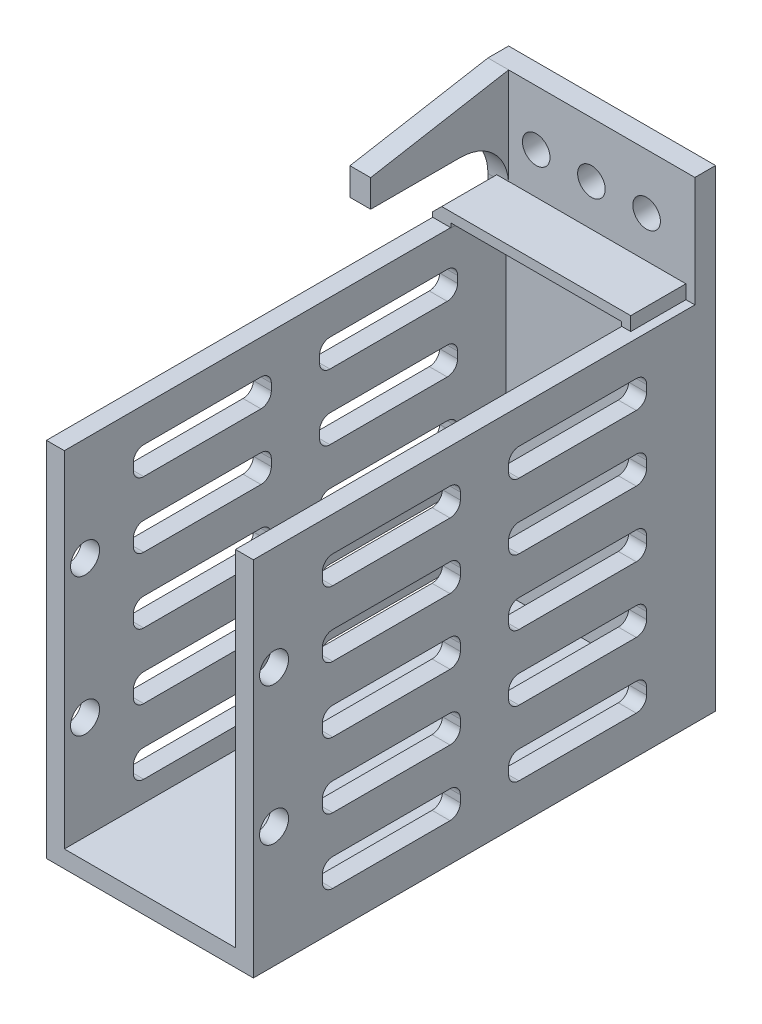
from build123d import *

# Parameters (mm, degrees)
BOSS_EXTRUDE1_DEPTH = 3
SKETCH2_W           = 2.6
SKETCH2_H           = 50
BOSS_EXTRUDE2_DEPTH = 64
SKETCH3_R           = 2
CUT_EXTRUDE1_DEPTH  = 143.577208896
SKETCH4_W           = 30
SKETCH4_H           = 67
BOSS_EXTRUDE3_DEPTH = 2.5
CUT_EXTRUDE2_DEPTH  = 131.265360039
SKETCH7_R           = 2.1
CUT_EXTRUDE3_DEPTH  = 131.265360039
BOSS_EXTRUDE4_DEPTH = 8
SKETCH9_W           = 3
SKETCH9_H           = 3.5
BOSS_EXTRUDE5_DEPTH = 20
CHAMFER1_SIZE       = 4
CHAMFER1_SIZE_2     = 22.685127278
FILLET1_R           = 7
CHAMFER2_SIZE       = 2


with BuildPart() as part:
    # Sketch1 → Boss-Extrude1 (new body)
    with BuildSketch(Plane.XY):
        Polygon((-72, -55.110705908), (-72, -105.110705908), (-42, -105.110705908), (-42, -55.110705908), (-42, -39.110705908), (-72, -39.110705908), align=None)
    extrude(amount=BOSS_EXTRUDE1_DEPTH)

    # Sketch2 → Boss-Extrude2 (add)
    with BuildSketch(Plane.XY.offset(3)):
        with Locations((-70.7, -80.110705908)):
            Rectangle(SKETCH2_W, SKETCH2_H)
        with Locations((-43.3, -80.110705908)):
            Rectangle(SKETCH2_W, SKETCH2_H)
    extrude(amount=BOSS_EXTRUDE2_DEPTH)

    # Sketch3 → Cut-Extrude1 (cut, through all)
    with BuildSketch(Plane.XY.offset(3)):
        with Locations((-65, -47.110705908)):
            Circle(SKETCH3_R)
        with Locations((-57, -47.110705908)):
            Circle(SKETCH3_R)
        with Locations((-49, -47.110705908)):
            Circle(SKETCH3_R)
    extrude(amount=-CUT_EXTRUDE1_DEPTH, mode=Mode.SUBTRACT)

    # Sketch4 → Boss-Extrude3 (add)
    with BuildSketch(Plane.XZ.offset(105.110705908)):
        with Locations((-57, 33.5)):
            Rectangle(SKETCH4_W, SKETCH4_H)
    extrude(amount=BOSS_EXTRUDE3_DEPTH)

    # Sketch5 → Cut-Extrude2 (cut, through all)
    with BuildSketch(Plane.ZY.offset(72)):
        with BuildLine():
            Line((55.5, -60.110705908), (38.5, -60.110705908))
            ThreePointArc((38.5, -60.110705908), (37.439339828, -60.550045736), (37, -61.610705908))
            Line((37, -61.610705908), (37, -62.610705908))
            ThreePointArc((37, -62.610705908), (37.439339828, -63.67136608), (38.5, -64.110705908))
            Line((38.5, -64.110705908), (55.5, -64.110705908))
            ThreePointArc((55.5, -64.110705908), (56.560660172, -63.67136608), (57, -62.610705908))
            Line((57, -62.610705908), (57, -61.610705908))
            ThreePointArc((57, -61.610705908), (56.560660172, -60.550045736), (55.5, -60.110705908))
        make_face()
        with BuildLine():
            Line((57, -71.110705908), (57, -72.110705908))
            ThreePointArc((57, -72.110705908), (56.560660172, -73.17136608), (55.5, -73.610705908))
            Line((55.5, -73.610705908), (38.5, -73.610705908))
            ThreePointArc((38.5, -73.610705908), (37.439339828, -73.17136608), (37, -72.110705908))
            Line((37, -72.110705908), (37, -71.110705908))
            ThreePointArc((37, -71.110705908), (37.439339828, -70.050045736), (38.5, -69.610705908))
            Line((38.5, -69.610705908), (55.5, -69.610705908))
            ThreePointArc((55.5, -69.610705908), (56.560660172, -70.050045736), (57, -71.110705908))
        make_face()
        with BuildLine():
            Line((57, -80.610705908), (57, -81.610705908))
            ThreePointArc((57, -81.610705908), (56.560660172, -82.67136608), (55.5, -83.110705908))
            Line((55.5, -83.110705908), (38.5, -83.110705908))
            ThreePointArc((38.5, -83.110705908), (37.439339828, -82.67136608), (37, -81.610705908))
            Line((37, -81.610705908), (37, -80.610705908))
            ThreePointArc((37, -80.610705908), (37.439339828, -79.550045736), (38.5, -79.110705908))
            Line((38.5, -79.110705908), (55.5, -79.110705908))
            ThreePointArc((55.5, -79.110705908), (56.560660172, -79.550045736), (57, -80.610705908))
        make_face()
        with BuildLine():
            Line((57, -90.110705908), (57, -91.110705908))
            ThreePointArc((57, -91.110705908), (56.560660172, -92.17136608), (55.5, -92.610705908))
            Line((55.5, -92.610705908), (38.5, -92.610705908))
            ThreePointArc((38.5, -92.610705908), (37.439339828, -92.17136608), (37, -91.110705908))
            Line((37, -91.110705908), (37, -90.110705908))
            ThreePointArc((37, -90.110705908), (37.439339828, -89.050045736), (38.5, -88.610705908))
            Line((38.5, -88.610705908), (55.5, -88.610705908))
            ThreePointArc((55.5, -88.610705908), (56.560660172, -89.050045736), (57, -90.110705908))
        make_face()
        with BuildLine():
            Line((57, -99.610705908), (57, -100.610705908))
            ThreePointArc((57, -100.610705908), (56.560660172, -101.67136608), (55.5, -102.110705908))
            Line((55.5, -102.110705908), (38.5, -102.110705908))
            ThreePointArc((38.5, -102.110705908), (37.439339828, -101.67136608), (37, -100.610705908))
            Line((37, -100.610705908), (37, -99.610705908))
            ThreePointArc((37, -99.610705908), (37.439339828, -98.550045736), (38.5, -98.110705908))
            Line((38.5, -98.110705908), (55.5, -98.110705908))
            ThreePointArc((55.5, -98.110705908), (56.560660172, -98.550045736), (57, -99.610705908))
        make_face()
        with BuildLine():
            Line((11.5, -102.110705908), (28.5, -102.110705908))
            ThreePointArc((28.5, -102.110705908), (29.560660172, -101.67136608), (30, -100.610705908))
            Line((30, -100.610705908), (30, -99.610705908))
            ThreePointArc((30, -99.610705908), (29.560660172, -98.550045736), (28.5, -98.110705908))
            Line((28.5, -98.110705908), (11.5, -98.110705908))
            ThreePointArc((11.5, -98.110705908), (10.439339828, -98.550045736), (10, -99.610705908))
            Line((10, -99.610705908), (10, -100.610705908))
            ThreePointArc((10, -100.610705908), (10.439339828, -101.67136608), (11.5, -102.110705908))
        make_face()
        with BuildLine():
            Line((11.5, -92.610705908), (28.5, -92.610705908))
            ThreePointArc((28.5, -92.610705908), (29.560660172, -92.17136608), (30, -91.110705908))
            Line((30, -91.110705908), (30, -90.110705908))
            ThreePointArc((30, -90.110705908), (29.560660172, -89.050045736), (28.5, -88.610705908))
            Line((28.5, -88.610705908), (11.5, -88.610705908))
            ThreePointArc((11.5, -88.610705908), (10.439339828, -89.050045736), (10, -90.110705908))
            Line((10, -90.110705908), (10, -91.110705908))
            ThreePointArc((10, -91.110705908), (10.439339828, -92.17136608), (11.5, -92.610705908))
        make_face()
        with BuildLine():
            Line((11.5, -83.110705908), (28.5, -83.110705908))
            ThreePointArc((28.5, -83.110705908), (29.560660172, -82.67136608), (30, -81.610705908))
            Line((30, -81.610705908), (30, -80.610705908))
            ThreePointArc((30, -80.610705908), (29.560660172, -79.550045736), (28.5, -79.110705908))
            Line((28.5, -79.110705908), (11.5, -79.110705908))
            ThreePointArc((11.5, -79.110705908), (10.439339828, -79.550045736), (10, -80.610705908))
            Line((10, -80.610705908), (10, -81.610705908))
            ThreePointArc((10, -81.610705908), (10.439339828, -82.67136608), (11.5, -83.110705908))
        make_face()
        with BuildLine():
            Line((11.5, -73.610705908), (28.5, -73.610705908))
            ThreePointArc((28.5, -73.610705908), (29.560660172, -73.17136608), (30, -72.110705908))
            Line((30, -72.110705908), (30, -71.110705908))
            ThreePointArc((30, -71.110705908), (29.560660172, -70.050045736), (28.5, -69.610705908))
            Line((28.5, -69.610705908), (11.5, -69.610705908))
            ThreePointArc((11.5, -69.610705908), (10.439339828, -70.050045736), (10, -71.110705908))
            Line((10, -71.110705908), (10, -72.110705908))
            ThreePointArc((10, -72.110705908), (10.439339828, -73.17136608), (11.5, -73.610705908))
        make_face()
        with BuildLine():
            Line((30, -61.610705908), (30, -62.610705908))
            ThreePointArc((30, -62.610705908), (29.560660172, -63.67136608), (28.5, -64.110705908))
            Line((28.5, -64.110705908), (11.5, -64.110705908))
            ThreePointArc((11.5, -64.110705908), (10.439339828, -63.67136608), (10, -62.610705908))
            Line((10, -62.610705908), (10, -61.610705908))
            ThreePointArc((10, -61.610705908), (10.439339828, -60.550045736), (11.5, -60.110705908))
            Line((11.5, -60.110705908), (28.5, -60.110705908))
            ThreePointArc((28.5, -60.110705908), (29.560660172, -60.550045736), (30, -61.610705908))
        make_face()
    extrude(amount=-CUT_EXTRUDE2_DEPTH, mode=Mode.SUBTRACT)

    # Sketch7 → Cut-Extrude3 (cut, through all)
    with BuildSketch(Plane.ZY.offset(72)):
        with Locations((64, -70.110705908)):
            Circle(SKETCH7_R)
        with Locations((64, -90.110705908)):
            Circle(SKETCH7_R)
    extrude(amount=-CUT_EXTRUDE3_DEPTH, mode=Mode.SUBTRACT)

    # Sketch8 → Boss-Extrude4 (add)
    with BuildSketch(Plane.XY.offset(3)):
        Polygon((-69.338828218, -54.510705908), (-44.661171782, -54.510705908), (-44.661171782, -55.110705908), (-43.3, -55.110705908), (-43.3, -53.110705908), (-44.661171782, -53.110705908), (-69.338828218, -53.110705908), (-70.7, -53.110705908), (-70.7, -55.110705908), (-69.338828218, -55.110705908), align=None)
    extrude(amount=BOSS_EXTRUDE4_DEPTH)

    # Sketch9 → Boss-Extrude5 (add)
    with BuildSketch(Plane.XY.offset(3)):
        with Locations((-70.5, -44.860705908)):
            Rectangle(SKETCH9_W, SKETCH9_H)
    extrude(amount=BOSS_EXTRUDE5_DEPTH)

    # Chamfer1
    # the kernel refuses this chamfer: 22.685127278, 4 mm, written as the material it adds along each edge
    with BuildSketch(Plane(origin=(-72, -43.110705908, 3), x_dir=(0, 0.9776715712462578, -0.21013876076743523), z_dir=(1, 0, 0))) as chamfer1_piece_1_section:
        Polygon((CHAMFER1_SIZE * 0.977671571246, CHAMFER1_SIZE * 0.210138760767), (-CHAMFER1_SIZE_2 * 0.210138760772, CHAMFER1_SIZE_2 * 0.977671571267), (0, 0), align=None)
    chamfer1_piece_1 = extrude(amount=3, mode=Mode.PRIVATE)
    chamfer1_piece_1 = split(chamfer1_piece_1, bisect_by=Plane(origin=(-70.5, -39.110705908, 10.531477983), z_dir=(0, -1, 0)), keep=Keep.TOP, mode=Mode.PRIVATE)
    chamfer1_piece_1 = split(chamfer1_piece_1, bisect_by=Plane(origin=(-70.5, -41.978640782, 23), z_dir=(0, 0, -1)), keep=Keep.TOP, mode=Mode.PRIVATE)
    add(chamfer1_piece_1)

    # Fillet1
    # the kernel refuses this fillet: 7 mm, written as the material it adds along each edge
    with BuildSketch(Plane(origin=(-69, -46.610705908, 3), x_dir=(0, -1, 0), z_dir=(-1, 0, 0))) as fillet1_piece_1:
        with BuildLine():
            CenterArc((FILLET1_R, FILLET1_R), FILLET1_R, 180, 90)
            Line((0, FILLET1_R), (0, 0))
            Line((0, 0), (FILLET1_R, 0))
        make_face()
    extrude(amount=3)

    # Chamfer2
    # the kernel refuses this chamfer: 2 mm, written as the material it adds along each edge
    with BuildSketch(Plane(origin=(-70.7, -55.110705908, 3), x_dir=(-0.9996219169112968, -0.02749587661058555, 0), z_dir=(0, 0, 1))) as chamfer2_piece_1_section:
        Polygon((CHAMFER2_SIZE * 0.999621916911, -CHAMFER2_SIZE * 0.0274958766106), (-CHAMFER2_SIZE * 0.0274958766106, -CHAMFER2_SIZE * 0.999621916911), (0, 0), align=None)
    chamfer2_piece_1 = extrude(amount=8, mode=Mode.PRIVATE)
    chamfer2_piece_1 = split(chamfer2_piece_1, bisect_by=Plane(origin=(-72, -54.751924688, 3.049621078), z_dir=(1, 0, 0)), keep=Keep.TOP, mode=Mode.PRIVATE)
    add(chamfer2_piece_1)


solid = part.part
